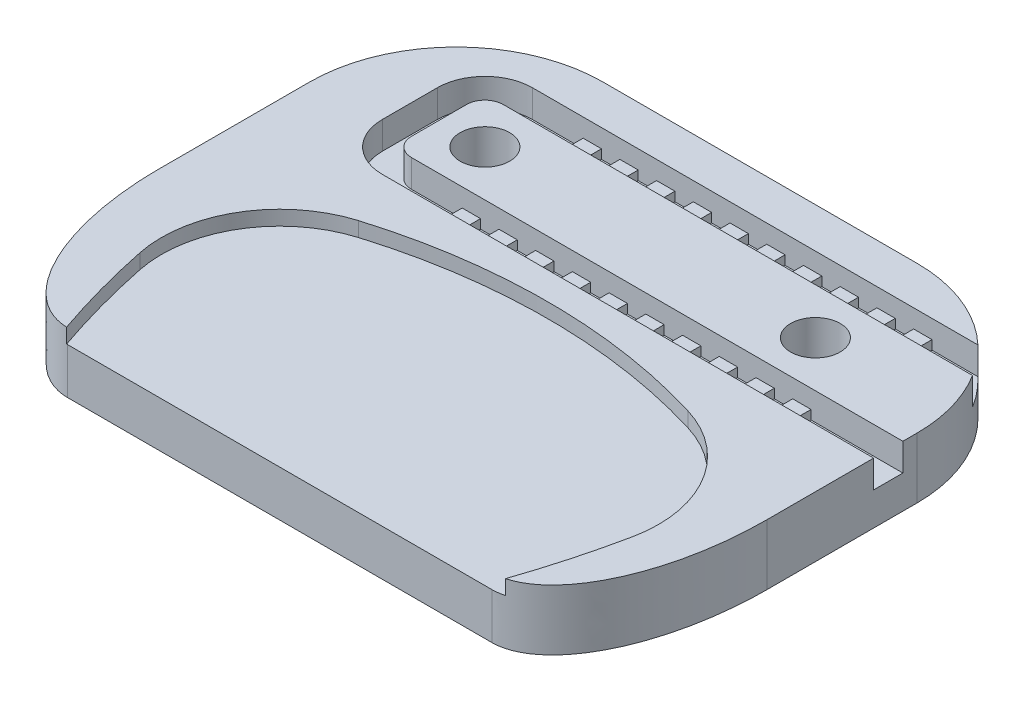
from build123d import *

# Parameters (mm, degrees)
BOSS_EXTRUDE1_DEPTH        = 0.8
BOSS_EXTRUDE4_START        = -0.8
BOSS_EXTRUDE4_DEPTH        = 2.5
CUT_EXTRUDE2_DEPTH         = 1.5
M2_5_CLEARANCE_HOLE1_D     = 2.7
M2_5_CLEARANCE_HOLE1_DEPTH = 11.188838164
M2_5_CLEARANCE_HOLE1_TIP   = 0.811161836
BOSS_EXTRUDE7_START        = -1.5
SKETCH11_W                 = 1
SKETCH11_H                 = 1.5875
BOSS_EXTRUDE7_DEPTH        = 0.5
LPATTERN2_COUNT            = 10
LPATTERN2_PITCH            = 2
FILLET4_R                  = 8
FILLET6_SIZE               = 5
FILLET6_SIZE_2             = 10
FILLET7_SIZE               = 5
FILLET7_SIZE_2             = 10


with BuildPart() as part:
    # Sketch3 → Boss-Extrude1 (new body)
    with BuildSketch(Plane(origin=(0, 0, 0), x_dir=(1, 0, 0), z_dir=(0, 1, 0))):
        with BuildLine():
            ThreePointArc((-8.964400592, 29.591990842), (0, 30.92), (8.964400592, 29.591990842))
            ThreePointArc((8.964400592, 29.591990842), (12.633049801, 26.719344266), (13.403780114, 22.124014011))
            ThreePointArc((13.403780114, 22.124014011), (12.736333478, 19.347857063), (11.892930693, 16.62))
            Line((11.892930693, 16.62), (16.263283948, 16.62))
            Line((16.263283948, 16.62), (16.263283948, 42.786292272))
            Line((16.263283948, 42.786292272), (-16.835608917, 42.786292272))
            Line((-16.835608917, 42.786292272), (-16.835608917, 16.62))
            Line((-16.835608917, 16.62), (-11.892930693, 16.62))
            ThreePointArc((-11.892930693, 16.62), (-12.736333478, 19.347857063), (-13.403780114, 22.124014011))
            ThreePointArc((-13.403780114, 22.124014011), (-12.633049801, 26.719344266), (-8.964400592, 29.591990842))
        make_face()
        with BuildLine():
            Line((-10.5, 32.42), (16.263283948, 32.42))
            Line((16.263283948, 32.42), (16.263283948, 34.0075))
            Line((16.263283948, 34.0075), (-10.5, 34.0075))
            ThreePointArc((-10.5, 34.0075), (-11.207106781, 34.300393219), (-11.5, 35.0075))
            Line((-11.5, 35.0075), (-11.5, 38.0075))
            ThreePointArc((-11.5, 38.0075), (-11.207106781, 38.714606781), (-10.5, 39.0075))
            Line((-10.5, 39.0075), (16.263283948, 39.0075))
            Line((16.263283948, 39.0075), (16.263283948, 40.595))
            Line((16.263283948, 40.595), (-10.5, 40.595))
            ThreePointArc((-10.5, 40.595), (-12.329638796, 39.837138796), (-13.0875, 38.0075))
            Line((-13.0875, 38.0075), (-13.0875, 35.0075))
            ThreePointArc((-13.0875, 35.0075), (-12.329638796, 33.177861204), (-10.5, 32.42))
        make_face()
        with BuildLine():
            Line((-10.5, 34.0075), (16.263283948, 34.0075))
            Line((16.263283948, 34.0075), (16.263283948, 39.0075))
            Line((16.263283948, 39.0075), (-10.5, 39.0075))
            ThreePointArc((-10.5, 39.0075), (-11.207106781, 38.714606781), (-11.5, 38.0075))
            Line((-11.5, 38.0075), (-11.5, 35.0075))
            ThreePointArc((-11.5, 35.0075), (-11.207106781, 34.300393219), (-10.5, 34.0075))
        make_face()
    extrude(amount=-BOSS_EXTRUDE1_DEPTH)

    # Sketch3<5> → Boss-Extrude4 (add)
    with BuildSketch(Plane(origin=(0, 0, 0), x_dir=(1, 0, 0), z_dir=(0, 1, 0)).offset(BOSS_EXTRUDE4_START)):
        with BuildLine():
            ThreePointArc((-8.964400592, 29.591990842), (0, 30.92), (8.964400592, 29.591990842))
            ThreePointArc((8.964400592, 29.591990842), (12.633049801, 26.719344266), (13.403780114, 22.124014011))
            ThreePointArc((13.403780114, 22.124014011), (12.736333478, 19.347857063), (11.892930693, 16.62))
            Line((11.892930693, 16.62), (16.263283948, 16.62))
            Line((16.263283948, 16.62), (16.263283948, 42.786292272))
            Line((16.263283948, 42.786292272), (-16.835608917, 42.786292272))
            Line((-16.835608917, 42.786292272), (-16.835608917, 16.62))
            Line((-16.835608917, 16.62), (-11.892930693, 16.62))
            ThreePointArc((-11.892930693, 16.62), (-12.736333478, 19.347857063), (-13.403780114, 22.124014011))
            ThreePointArc((-13.403780114, 22.124014011), (-12.633049801, 26.719344266), (-8.964400592, 29.591990842))
        make_face()
        with BuildLine():
            ThreePointArc((8.964400592, 29.591990842), (12.633049801, 26.719344266), (13.403780114, 22.124014011))
            ThreePointArc((13.403780114, 22.124014011), (12.736333478, 19.347857063), (11.892930693, 16.62))
            Line((11.892930693, 16.62), (-11.892930693, 16.62))
            ThreePointArc((-11.892930693, 16.62), (-12.736333478, 19.347857063), (-13.403780114, 22.124014011))
            ThreePointArc((-13.403780114, 22.124014011), (-12.633049801, 26.719344266), (-8.964400592, 29.591990842))
            ThreePointArc((-8.964400592, 29.591990842), (0, 30.92), (8.964400592, 29.591990842))
        make_face()
        with BuildLine():
            Line((-10.5, 32.42), (16.263283948, 32.42))
            Line((16.263283948, 32.42), (16.263283948, 34.0075))
            Line((16.263283948, 34.0075), (-10.5, 34.0075))
            ThreePointArc((-10.5, 34.0075), (-11.207106781, 34.300393219), (-11.5, 35.0075))
            Line((-11.5, 35.0075), (-11.5, 38.0075))
            ThreePointArc((-11.5, 38.0075), (-11.207106781, 38.714606781), (-10.5, 39.0075))
            Line((-10.5, 39.0075), (16.263283948, 39.0075))
            Line((16.263283948, 39.0075), (16.263283948, 40.595))
            Line((16.263283948, 40.595), (-10.5, 40.595))
            ThreePointArc((-10.5, 40.595), (-12.329638796, 39.837138796), (-13.0875, 38.0075))
            Line((-13.0875, 38.0075), (-13.0875, 35.0075))
            ThreePointArc((-13.0875, 35.0075), (-12.329638796, 33.177861204), (-10.5, 32.42))
        make_face()
        with BuildLine():
            Line((-10.5, 34.0075), (16.263283948, 34.0075))
            Line((16.263283948, 34.0075), (16.263283948, 39.0075))
            Line((16.263283948, 39.0075), (-10.5, 39.0075))
            ThreePointArc((-10.5, 39.0075), (-11.207106781, 38.714606781), (-11.5, 38.0075))
            Line((-11.5, 38.0075), (-11.5, 35.0075))
            ThreePointArc((-11.5, 35.0075), (-11.207106781, 34.300393219), (-10.5, 34.0075))
        make_face()
    extrude(amount=-BOSS_EXTRUDE4_DEPTH)

    # Sketch3<7> → Cut-Extrude2 (cut)
    with BuildSketch(Plane(origin=(0, 0, 0), x_dir=(1, 0, 0), z_dir=(0, 1, 0))):
        with BuildLine():
            Line((-10.5, 32.42), (16.263283948, 32.42))
            Line((16.263283948, 32.42), (16.263283948, 34.0075))
            Line((16.263283948, 34.0075), (-10.5, 34.0075))
            ThreePointArc((-10.5, 34.0075), (-11.207106781, 34.300393219), (-11.5, 35.0075))
            Line((-11.5, 35.0075), (-11.5, 38.0075))
            ThreePointArc((-11.5, 38.0075), (-11.207106781, 38.714606781), (-10.5, 39.0075))
            Line((-10.5, 39.0075), (16.263283948, 39.0075))
            Line((16.263283948, 39.0075), (16.263283948, 40.595))
            Line((16.263283948, 40.595), (-10.5, 40.595))
            ThreePointArc((-10.5, 40.595), (-12.329638796, 39.837138796), (-13.0875, 38.0075))
            Line((-13.0875, 38.0075), (-13.0875, 35.0075))
            ThreePointArc((-13.0875, 35.0075), (-12.329638796, 33.177861204), (-10.5, 32.42))
        make_face()
    extrude(amount=-CUT_EXTRUDE2_DEPTH, mode=Mode.SUBTRACT)

    # M2.5 Clearance Hole1
    with Locations(Plane(origin=(0, 0, 0), x_dir=(1, 0, 0), z_dir=(0, 1, 0))):
        with Locations((-9, 36.5075), (9, 36.5075)):
            Hole(M2_5_CLEARANCE_HOLE1_D / 2, depth=M2_5_CLEARANCE_HOLE1_DEPTH)
            with Locations((0, 0, -(M2_5_CLEARANCE_HOLE1_DEPTH + M2_5_CLEARANCE_HOLE1_TIP / 2))):  # 118° drill point
                Cone(0, M2_5_CLEARANCE_HOLE1_D / 2, M2_5_CLEARANCE_HOLE1_TIP, mode=Mode.SUBTRACT)

    # Sketch11 → Boss-Extrude7 (add)
    with BuildSketch(Plane(origin=(0, 0, 0), x_dir=(1, 0, 0), z_dir=(0, 1, 0)).offset(BOSS_EXTRUDE7_START)):
        with Locations((10.763283948, 39.80125)):
            Rectangle(SKETCH11_W, SKETCH11_H)
        with Locations((10.763283948, 33.21375)):
            Rectangle(SKETCH11_W, SKETCH11_H)
    boss_extrude7 = extrude(amount=BOSS_EXTRUDE7_DEPTH)

    # LPattern2: Boss-Extrude7 ×10
    with Locations(*[(-i * LPATTERN2_PITCH, 0, 0) for i in range(1, LPATTERN2_COUNT)]):
        add(boss_extrude7)

    # Fillet4
    fillet4_edges = [part.edges().sort_by_distance(p)[0] for p in [
        (16.263283948, -1.65, -42.786292272),
        (-16.835608917, -1.65, -42.786292272),
    ]]
    fillet(fillet4_edges, radius=FILLET4_R)

    # Fillet6
    # an asymmetric fillet: 10, 5 mm, written as the material it takes off along each edge
    with BuildSketch(Plane(origin=(16.263283948, -28.3, -16.62), x_dir=(-1, 0, 0), z_dir=(0, 1, 0))) as fillet6_piece_1:
        with BuildLine():
            Bezier((FILLET6_SIZE, 0), (0, 0), (0, -FILLET6_SIZE_2), weights=[1, 0.707106781, 1])
            Line((0, -FILLET6_SIZE_2), (0, 0))
            Line((0, 0), (FILLET6_SIZE, 0))
        make_face()
    extrude(amount=53.3, mode=Mode.SUBTRACT)

    # Fillet7
    # an asymmetric fillet: 10, 5 mm, written as the material it takes off along each edge
    with BuildSketch(Plane(origin=(-16.835608917, 25, -16.62), x_dir=(1, 0, 0), z_dir=(0, -1, 0))) as fillet7_piece_1:
        with BuildLine():
            Bezier((FILLET7_SIZE, 0), (0, 0), (0, -FILLET7_SIZE_2), weights=[1, 0.707106781, 1])
            Line((0, -FILLET7_SIZE_2), (0, 0))
            Line((0, 0), (FILLET7_SIZE, 0))
        make_face()
    extrude(amount=53.3, mode=Mode.SUBTRACT)


solid = part.part
